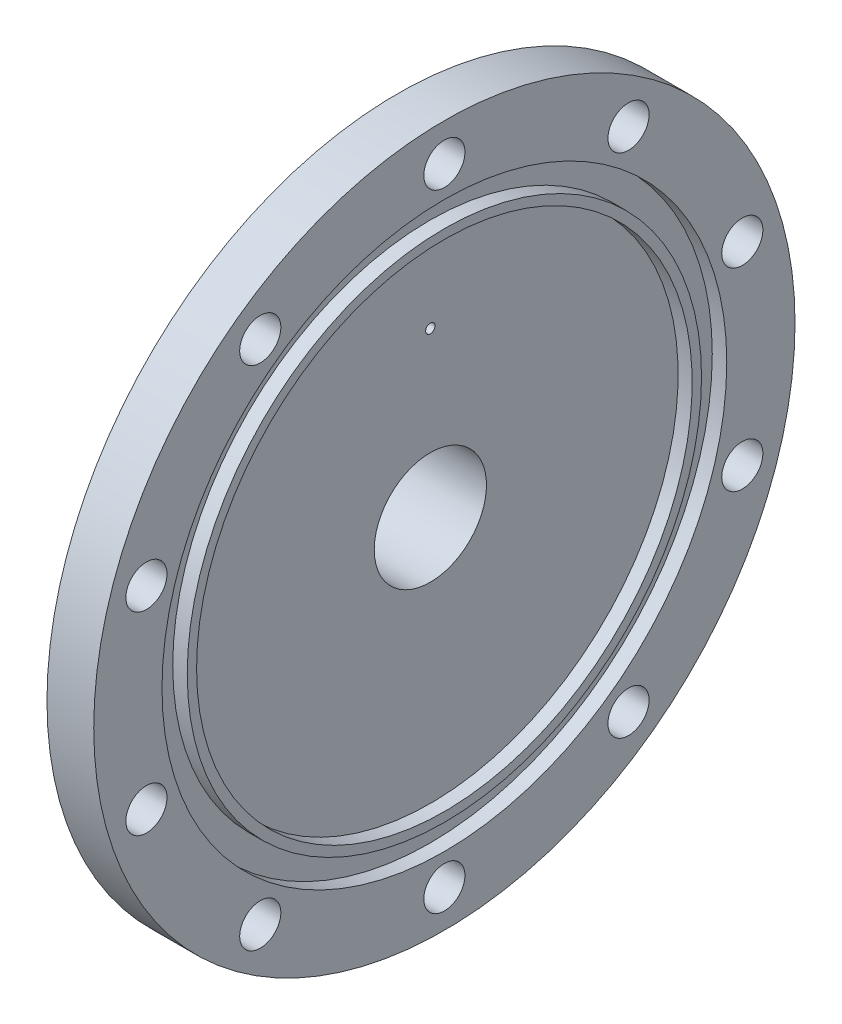
from build123d import *

# Parameters (mm, degrees)
SKETCH2_R           = 2.1
CUT_EXTRUDE1_DEPTH  = 6
CIRPATTERN1_COUNT   = 6
CUT_EXTRUDE2_REACH  = 108.536
SKETCH3_R           = 4.4
CIRPATTERN2_COUNT   = 10
BOSS_EXTRUDE1_START = 10
SKETCH4_R           = 5.5
BOSS_EXTRUDE1_DEPTH = 10
SKETCH5_R           = 5.5
CUT_EXTRUDE3_DEPTH  = 3
CUT_EXTRUDE4_REACH  = 108.86
SKETCH6_R           = 1


with BuildPart() as part:
    # Sketch1 → Revolve1 (revolve)
    with BuildSketch(Plane.XY):
        Polygon((0, 12), (17, 12), (17, 53), (20, 53), (20, 55), (16.9, 55), (16.9, 60.4), (20, 60.4), (20, 75), (10, 75), (10, 24), (0, 24), align=None)
    revolve(axis=Axis((0, 0, 0), (1, 0, 0)))

    # Sketch2 → Cut-Extrude1 (cut)
    with BuildSketch(Plane.ZY):
        with Locations((0, 18)):
            Circle(SKETCH2_R)
    cut_extrude1 = extrude(amount=-CUT_EXTRUDE1_DEPTH, mode=Mode.SUBTRACT)

    # CirPattern1: Cut-Extrude1 ×6 about axis
    cirpattern1_axis = Axis((0, 0, 0), (-1, 0, 0))
    for i in range(1, CIRPATTERN1_COUNT):
        add(cut_extrude1.rotate(cirpattern1_axis, i * 360 / CIRPATTERN1_COUNT), mode=Mode.SUBTRACT)

    # Sketch3 → Cut-Extrude2 (cut, up to next)
    with BuildSketch(Plane.ZY.offset(-10), mode=Mode.PRIVATE) as cut_extrude2_sk1:
        with Locations((0, 67)):
            Circle(SKETCH3_R)
    cut_extrude2_tool1 = extrude(cut_extrude2_sk1.sketch, amount=-CUT_EXTRUDE2_REACH, mode=Mode.PRIVATE) & part.part
    cut_extrude2 = cut_extrude2_tool1.solids().sort_by_distance((10, 67, 0))[0]
    add(cut_extrude2, mode=Mode.SUBTRACT)

    # CirPattern2: Cut-Extrude2 ×10 about axis
    cirpattern2_axis = Axis((10, 0, 0), (-1, 0, 0))
    for i in range(1, CIRPATTERN2_COUNT):
        add(cut_extrude2.rotate(cirpattern2_axis, i * 360 / CIRPATTERN2_COUNT), mode=Mode.SUBTRACT)

    # Sketch4 → Boss-Extrude1 (add)
    with BuildSketch(Plane.ZY.offset(-10).offset(BOSS_EXTRUDE1_START)):
        with BuildLine():
            Line((-21.84352517, 9.942857143), (-8.64639538, 38.935714286))
            ThreePointArc((-8.64639538, 38.935714286), (0, 44.5), (8.64639538, 38.935714286))
            Line((8.64639538, 38.935714286), (21.84352517, 9.942857143))
            ThreePointArc((21.84352517, 9.942857143), (0, 24), (-21.84352517, 9.942857143))
        make_face()
        with Locations((0, 35)):
            Circle(SKETCH4_R, mode=Mode.SUBTRACT)
    extrude(amount=-BOSS_EXTRUDE1_DEPTH)

    # Sketch5 → Cut-Extrude3 (cut)
    with BuildSketch(Plane.ZY.offset(-10)):
        with Locations((0, 35)):
            Circle(SKETCH5_R)
    extrude(amount=-CUT_EXTRUDE3_DEPTH, mode=Mode.SUBTRACT)

    # Sketch6 → Cut-Extrude4 (cut, up to next)
    with BuildSketch(Plane.ZY.offset(-13), mode=Mode.PRIVATE) as cut_extrude4_sk1:
        with Locations((0, 35)):
            Circle(SKETCH6_R)
    cut_extrude4_tool1 = extrude(cut_extrude4_sk1.sketch, amount=-CUT_EXTRUDE4_REACH, mode=Mode.PRIVATE) & part.part
    add(cut_extrude4_tool1.solids().sort_by_distance((13, 35, 0))[0], mode=Mode.SUBTRACT)


solid = part.part
